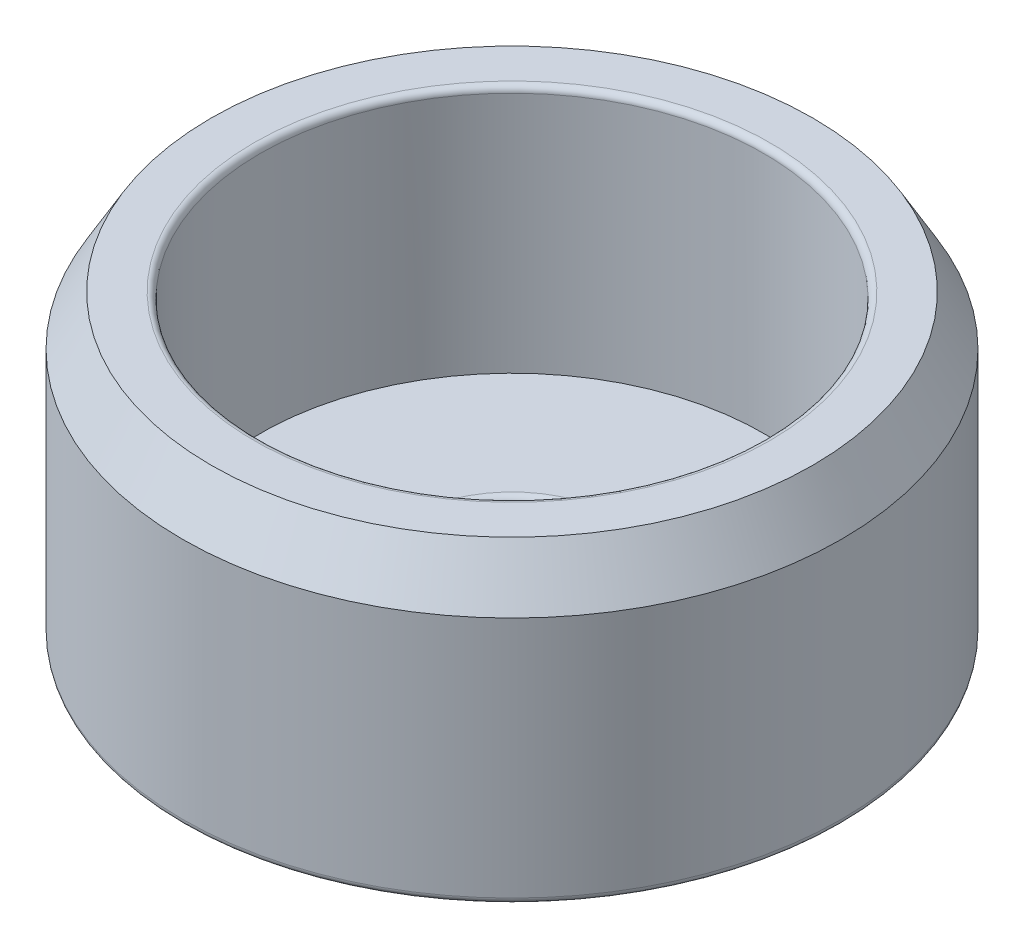
from build123d import *

# Parameters (mm, degrees)
OVERALL_FILLETS_R = 1
CIRPATTERN1_COUNT = 6


with BuildPart() as part:
    # Sketch1 → body (revolve)
    with BuildSketch(Plane.XY):
        Polygon((20, 0), (15.381197846, 8), (40.5, 8), (40.5, 48), (48.381197846, 48), (53, 40), (53, 0), align=None)
    revolve(axis=Axis((0, 0, 0), (0, 1, 0)))

    # overall_fillets
    overall_fillets_edges = [part.edges().sort_by_distance(p)[0] for p in [
        (-15.381197846, 8, 0),
        (-20, 0, 0),
        (-40.5, 48, 0),
        (-53, 0, 0),
    ]]
    fillet(overall_fillets_edges, radius=OVERALL_FILLETS_R)

    # Sketch4 → screw_holes (revolve, cut)
    with BuildSketch(Plane(origin=(43, 0, 0), x_dir=(0, 0, -1), z_dir=(1, 0, 0))):
        Polygon((0, 0), (0, 6.811161836), (1.35, 6), (1.35, 0.4), (1.75, 0), align=None)
    screw_holes = revolve(axis=Axis((43, -6.35, 0), (0, 1, 0)), mode=Mode.SUBTRACT)

    # CirPattern1: screw_holes ×6 about axis
    cirpattern1_axis = Axis((0, 6.5, 0), (0, 1, 0))
    for i in range(1, CIRPATTERN1_COUNT):
        add(screw_holes.rotate(cirpattern1_axis, i * 360 / CIRPATTERN1_COUNT), mode=Mode.SUBTRACT)


solid = part.part
